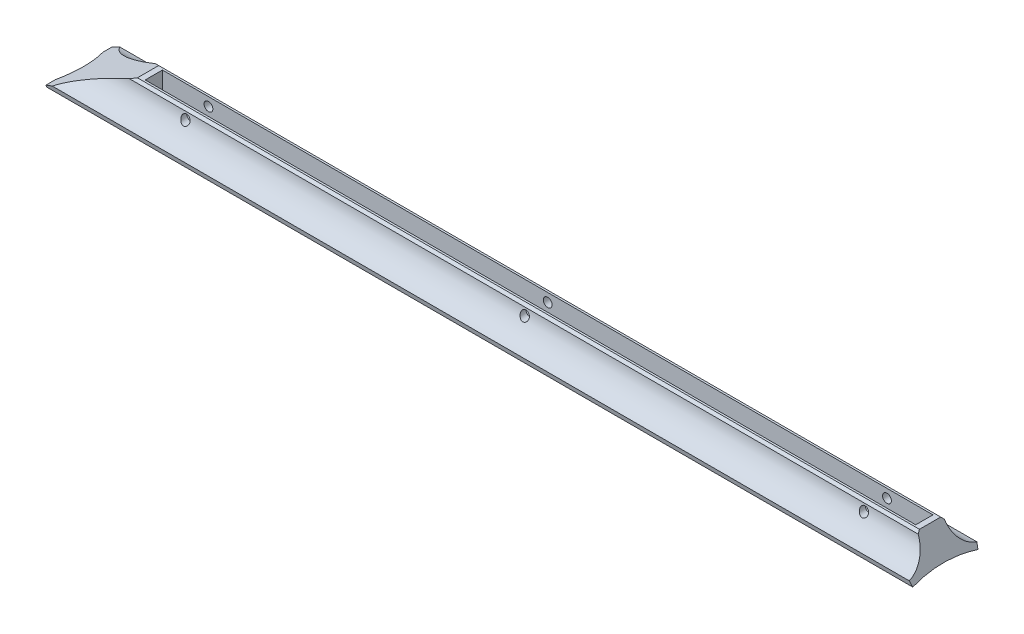
from build123d import *

# Parameters (mm, degrees)
BOSS_EXTRUDE1_DEPTH                 = 254
CUT_EXTRUDE1_DEPTH                  = 263.150751027
SKETCH3_W                           = 425.45
SKETCH3_H                           = 9.525
CUT_EXTRUDE2_DEPTH                  = 9.525
CUT_EXTRUDE3_REACH                  = 257.394
CUT_EXTRUDE3_END_RADIUS             = 15.089603758
SKETCH6_R                           = 2.4384
CUT_EXTRUDE3_DIRECTION_2_REACH      = 257.394
CUT_EXTRUDE3_DIRECTION_2_END_RADIUS = 15.089603758
CHAMFER1_SIZE                       = 1.27


with BuildPart() as part:
    # Sketch1 → Boss-Extrude1 (new, symmetric)
    with BuildSketch(Plane(origin=(0, 0, 0), x_dir=(0, 0, -1), z_dir=(1, 0, 0))):
        with BuildLine():
            Line((-7.1374, 12.7), (7.1374, 12.7))
            ThreePointArc((7.1374, 12.7), (10.363087786, 3.375642683), (18.661047774, -1.962199681))
            Line((18.661047774, -1.962199681), (18.00748716, -4.649455573))
            ThreePointArc((18.00748716, -4.649455573), (0, -2.491135768), (-18.00748716, -4.649455573))
            Line((-18.00748716, -4.649455573), (-18.661047774, -1.962199681))
            ThreePointArc((-18.661047774, -1.962199681), (-10.363087786, 3.375642683), (-7.1374, 12.7))
        make_face()
    extrude(amount=BOSS_EXTRUDE1_DEPTH, both=True)

    # Sketch2 → Cut-Extrude1 (cut, through all)
    with BuildSketch(Plane.XY.offset(44.944976028)):
        Polygon((-254, 12.7), (-215.9, 12.7), (-254, -3.6322), align=None)
        Polygon((254, -4.649455573), (224.3582, -4.649455573), (215.9, 12.7), (254, 12.7), align=None)
    extrude(amount=-CUT_EXTRUDE1_DEPTH, mode=Mode.SUBTRACT)

    # Sketch3 → Cut-Extrude2 (cut)
    with BuildSketch(Plane(origin=(0, 12.7, 0), x_dir=(1, 0, 0), z_dir=(0, 1, 0))):
        Rectangle(SKETCH3_W, SKETCH3_H)
    extrude(amount=-CUT_EXTRUDE2_DEPTH, mode=Mode.SUBTRACT)

    # Cut-Extrude3: up to this cylinder (the profile starts outside it)
    cut_extrude3_end = Plane(origin=(0, 12.7, -22.227003758), z_dir=(-1, 0, 0)) * Cylinder(CUT_EXTRUDE3_END_RADIUS, 920.617207515, mode=Mode.PRIVATE)
    # Sketch6 → Cut-Extrude3 (cut, up to the surface)
    with BuildSketch(Plane.XY.offset(-4.7625), mode=Mode.PRIVATE) as cut_extrude3_sk1:
        with Locations((-187.325, 7.9375)):
            Circle(SKETCH6_R)
    cut_extrude3_tool1 = extrude(cut_extrude3_sk1.sketch, amount=-CUT_EXTRUDE3_REACH, mode=Mode.PRIVATE) - cut_extrude3_end
    add(cut_extrude3_tool1.solids().sort_by_distance((-187.325, 7.9375, -4.7625))[0], mode=Mode.SUBTRACT)
    # Sketch6 → Cut-Extrude3 (cut, up to the surface)
    with BuildSketch(Plane.XY.offset(-4.7625), mode=Mode.PRIVATE) as cut_extrude3_sk2:
        with Locations((187.325, 7.9375)):
            Circle(SKETCH6_R)
    cut_extrude3_tool2 = extrude(cut_extrude3_sk2.sketch, amount=-CUT_EXTRUDE3_REACH, mode=Mode.PRIVATE) - cut_extrude3_end
    add(cut_extrude3_tool2.solids().sort_by_distance((187.325, 7.9375, -4.7625))[0], mode=Mode.SUBTRACT)
    # Sketch6 → Cut-Extrude3 (cut, up to the surface)
    with BuildSketch(Plane.XY.offset(-4.7625), mode=Mode.PRIVATE) as cut_extrude3_sk3:
        with Locations((0, 7.9375)):
            Circle(SKETCH6_R)
    cut_extrude3_tool3 = extrude(cut_extrude3_sk3.sketch, amount=-CUT_EXTRUDE3_REACH, mode=Mode.PRIVATE) - cut_extrude3_end
    add(cut_extrude3_tool3.solids().sort_by_distance((0, 7.9375, -4.7625))[0], mode=Mode.SUBTRACT)

    # Cut-Extrude3 direction 2: up to this cylinder (the profile starts outside it)
    cut_extrude3_direction_2_end = Plane(origin=(0, 12.7, 22.227003758), z_dir=(-1, 0, 0)) * Cylinder(CUT_EXTRUDE3_DIRECTION_2_END_RADIUS, 920.617207515, mode=Mode.PRIVATE)
    # Sketch6 → Cut-Extrude3 direction 2 (cut, up to the surface)
    with BuildSketch(Plane.XY.offset(-4.7625), mode=Mode.PRIVATE) as cut_extrude3_direction_2_sk1:
        with Locations((-187.325, 7.9375)):
            Circle(SKETCH6_R)
    cut_extrude3_direction_2_tool1 = extrude(cut_extrude3_direction_2_sk1.sketch, amount=CUT_EXTRUDE3_DIRECTION_2_REACH, mode=Mode.PRIVATE) - cut_extrude3_direction_2_end
    add(cut_extrude3_direction_2_tool1.solids().sort_by_distance((-187.325, 7.9375, -4.7625))[0], mode=Mode.SUBTRACT)
    # Sketch6 → Cut-Extrude3 direction 2 (cut, up to the surface)
    with BuildSketch(Plane.XY.offset(-4.7625), mode=Mode.PRIVATE) as cut_extrude3_direction_2_sk2:
        with Locations((187.325, 7.9375)):
            Circle(SKETCH6_R)
    cut_extrude3_direction_2_tool2 = extrude(cut_extrude3_direction_2_sk2.sketch, amount=CUT_EXTRUDE3_DIRECTION_2_REACH, mode=Mode.PRIVATE) - cut_extrude3_direction_2_end
    add(cut_extrude3_direction_2_tool2.solids().sort_by_distance((187.325, 7.9375, -4.7625))[0], mode=Mode.SUBTRACT)
    # Sketch6 → Cut-Extrude3 direction 2 (cut, up to the surface)
    with BuildSketch(Plane.XY.offset(-4.7625), mode=Mode.PRIVATE) as cut_extrude3_direction_2_sk3:
        with Locations((0, 7.9375)):
            Circle(SKETCH6_R)
    cut_extrude3_direction_2_tool3 = extrude(cut_extrude3_direction_2_sk3.sketch, amount=CUT_EXTRUDE3_DIRECTION_2_REACH, mode=Mode.PRIVATE) - cut_extrude3_direction_2_end
    add(cut_extrude3_direction_2_tool3.solids().sort_by_distance((0, 7.9375, -4.7625))[0], mode=Mode.SUBTRACT)

    # Chamfer1
    # the kernel refuses this chamfer: 1.27 mm, written as the material it takes off along each edge
    with BuildSketch(Plane(origin=(219.319487902, 12.7, -7.1374), x_dir=(0, 0, 1), z_dir=(-1, 0, 0))) as chamfer1_piece_1:
        with BuildLine():
            Line((CHAMFER1_SIZE, 0), (-0.058604027, -1.328604027))
            ThreePointArc((-0.058604027, -1.328604027), (-0.015497105, -0.683703283), (0, 0))
            Line((0, 0), (CHAMFER1_SIZE, 0))
        make_face()
    extrude(amount=438.638975803, mode=Mode.SUBTRACT)
    with BuildSketch(Plane(origin=(219.319487902, 12.7, 7.1374), x_dir=(0, -0.9990285943565428, 0.04406662748600431), z_dir=(-1, 0, 0))) as chamfer1_piece_2:
        with BuildLine():
            Line((1.329895895, 0), (-CHAMFER1_SIZE * 0.044066627486, -CHAMFER1_SIZE * 0.999028594357))
            Line((-CHAMFER1_SIZE * 0.044066627486, -CHAMFER1_SIZE * 0.999028594357), (0, 0))
            ThreePointArc((0, 0), (0.683722035, -0.014646447), (1.329895895, 0))
        make_face()
    extrude(amount=438.638975803, mode=Mode.SUBTRACT)


solid = part.part
